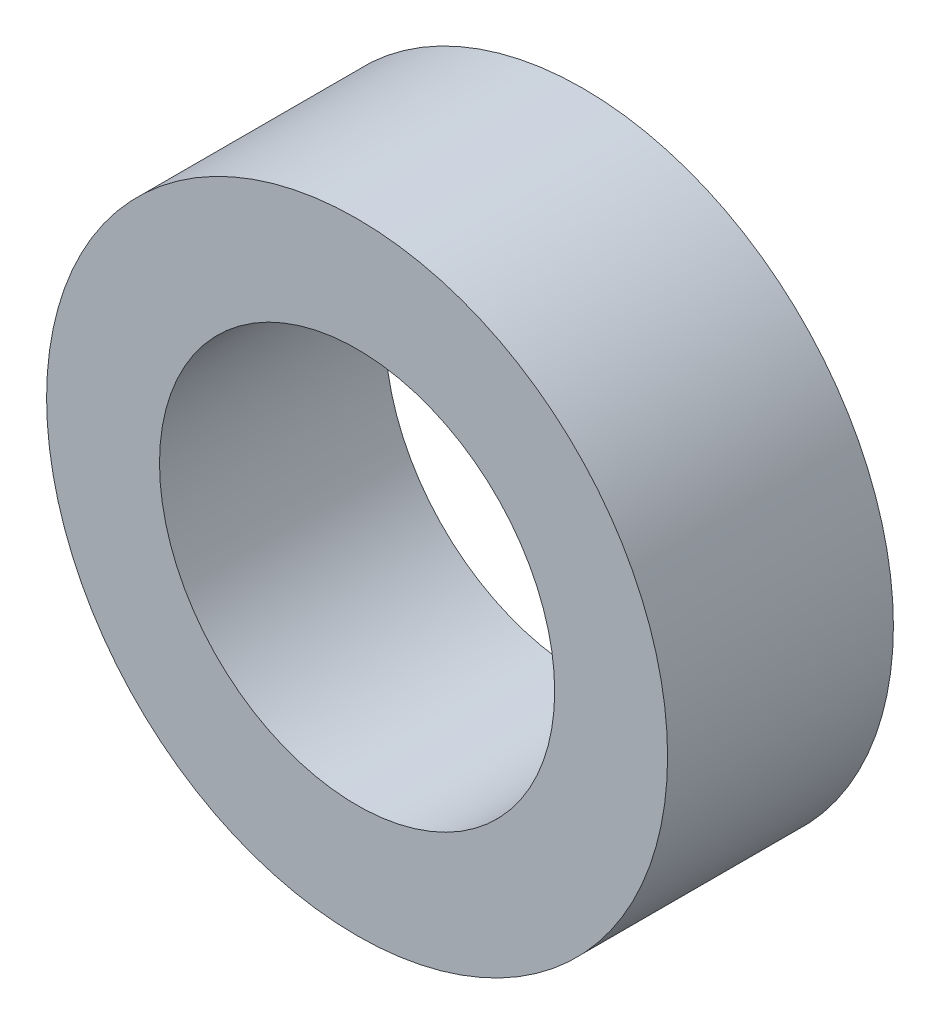
from build123d import *

# Parameters (mm, degrees)
SKETCH3_R           = 17.4625
SKETCH3_R_2         = 11.1125
BOSS_EXTRUDE1_DEPTH = 6.35


with BuildPart() as part:
    # Sketch3 → Boss-Extrude1 (new, symmetric)
    with BuildSketch(Plane.XY):
        Circle(SKETCH3_R)
        Circle(SKETCH3_R_2, mode=Mode.SUBTRACT)
    extrude(amount=BOSS_EXTRUDE1_DEPTH, both=True)


solid = part.part
